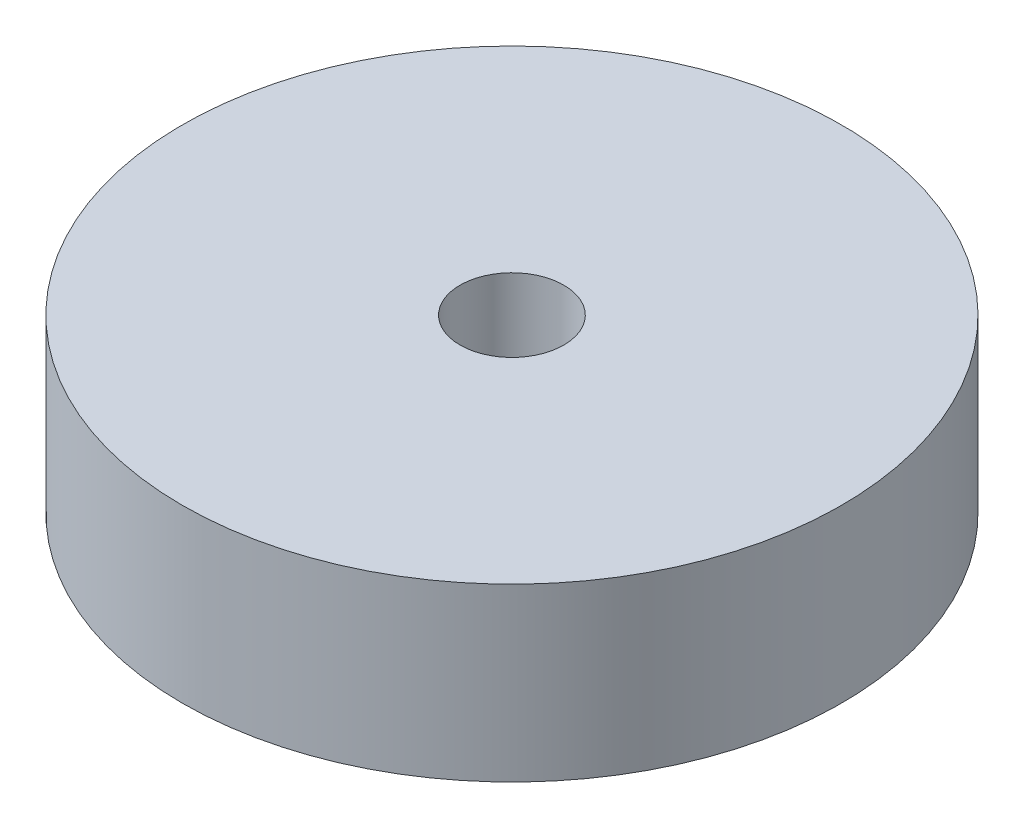
from build123d import *

# Parameters (mm, degrees)
SKETCH1_R           = 317.5
BOSS_EXTRUDE1_DEPTH = 165.1
SKETCH2_R           = 50
CUT_EXTRUDE1_DEPTH  = 479.404128327


with BuildPart() as part:
    # Sketch1 → Boss-Extrude1 (new body)
    with BuildSketch(Plane(origin=(0, 0, 0), x_dir=(1, 0, 0), z_dir=(0, 1, 0))):
        Circle(SKETCH1_R)
    extrude(amount=BOSS_EXTRUDE1_DEPTH)

    # Sketch2 → Cut-Extrude1 (cut, through all)
    with BuildSketch(Plane(origin=(0, 165.1, 0), x_dir=(1, 0, 0), z_dir=(0, 1, 0))):
        Circle(SKETCH2_R)
    extrude(amount=-CUT_EXTRUDE1_DEPTH, mode=Mode.SUBTRACT)


solid = part.part
